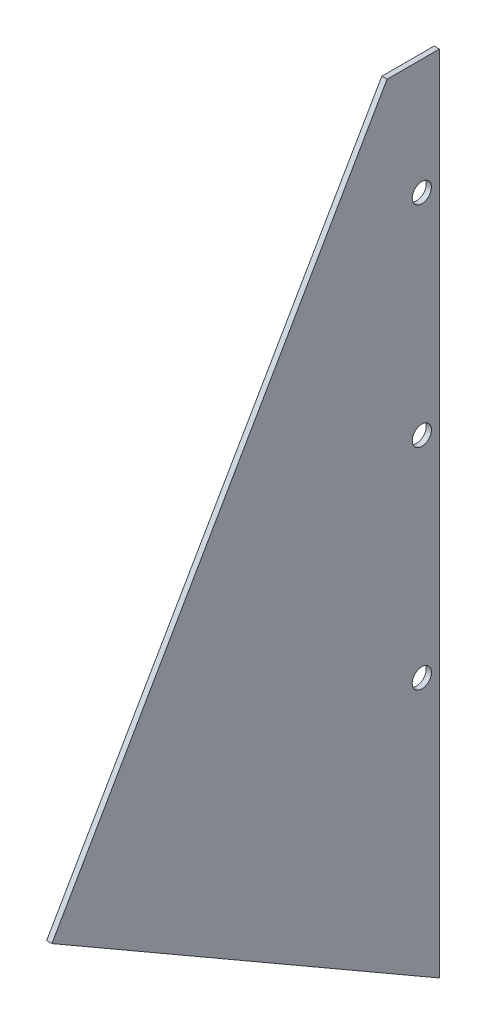
from build123d import *

# Parameters (mm, degrees)
SKETCH_1_W             = 1.5
SKETCH_1_H             = 186
SM_BASE_FLANGE_1_DEPTH = 130
SKETCH_6_R             = 2.75
CUT_EXTRUDE_1_DEPTH    = 227.932258615
CUT_EXTRUDE_2_DEPTH    = 10
CUT_EXTRUDE_4_DEPTH    = 10
EXTRUDE_1_DEPTH        = 1.5


# Sheet-metal steps are written as plain solids
with BuildPart() as part:
    # Sketch 1 → 基体-法兰1 (new body)
    with BuildSketch(Plane.XY):
        with Locations((0.75, 93)):
            Rectangle(SKETCH_1_W, SKETCH_1_H)
    extrude(amount=SM_BASE_FLANGE_1_DEPTH)

    # 草图6 → 切除-拉伸1 (cut, through all)
    with BuildSketch(Plane.ZY):
        with Locations((5, 153)):
            Circle(SKETCH_6_R)
        with Locations((5, 93)):
            Circle(SKETCH_6_R)
        with Locations(Location((5, 33, 0), (0, 0, 180))):
            Circle(SKETCH_6_R)
    extrude(amount=-CUT_EXTRUDE_1_DEPTH, mode=Mode.SUBTRACT)

    # 草图7 → 切除-拉伸2 (cut)
    with BuildSketch(Plane(origin=(1.5, 0, 0), x_dir=(0, 0, -1), z_dir=(1, 0, 0))):
        Polygon((-14.94, 186), (-130, 186), (-130, -13.441807708), align=None)
    extrude(amount=-CUT_EXTRUDE_2_DEPTH, mode=Mode.SUBTRACT)

    # 草图8 → 切除-拉伸4 (cut)
    with BuildSketch(Plane.ZY):
        Polygon((122.245284915, 0), (110.646921999, 20.104280083), (75.798721386, 0), align=None)
    extrude(amount=-CUT_EXTRUDE_4_DEPTH, mode=Mode.SUBTRACT)

    # 草图10 → 凸台-拉伸1 (add)
    with BuildSketch(Plane(origin=(1.5, 0, 0), x_dir=(0, 0, -1), z_dir=(1, 0, 0))):
        Polygon((-75.798721386, 0), (0, 0), (0, -43.729050508), align=None)
    extrude(amount=-EXTRUDE_1_DEPTH)


solid = part.part
